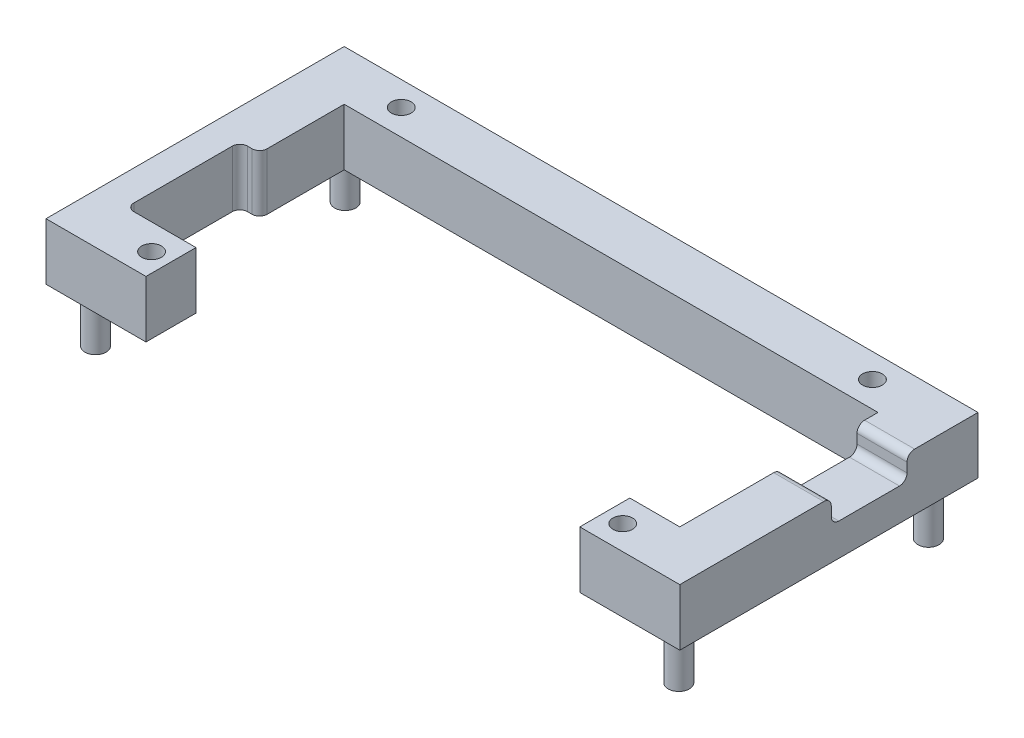
from build123d import *

# Parameters (mm, degrees)
SKETCH1_R           = 1.651
BOSS_EXTRUDE1_DEPTH = 9.525
SKETCH2_W           = 12.7
SKETCH2_H           = 4.099575227
CUT_EXTRUDE7_DEPTH  = 8.89
FILLET2_R           = 1.27
SKETCH3_R           = 1.778
BOSS_EXTRUDE3_DEPTH = 8.89
SKETCH4_W           = 3.302
SKETCH4_H           = 19.05
CUT_EXTRUDE8_DEPTH  = 193.603234356
FILLET3_R           = 1.27


with BuildPart() as part:
    # Sketch1 → Boss-Extrude1 (new body)
    with BuildSketch(Plane(origin=(0, 0, 0), x_dir=(1, 0, 0), z_dir=(0, 1, 0))):
        Polygon((75.155177047, 61.997896552), (75.155177047, 11.997896552), (91.919177047, 11.997896552), (91.919177047, 20.379896552), (83.537177047, 20.379896552), (83.537177047, 53.615896552), (173.037829354, 53.615896552), (173.037829354, 20.379896552), (164.655829354, 20.379896552), (164.655829354, 11.997896552), (181.419829354, 11.997896552), (181.419829354, 61.997896552), align=None)
        with Locations((167.7875512, 57.93100823)):
            Circle(SKETCH1_R, mode=Mode.SUBTRACT)
        with Locations((88.7874552, 57.93100823)):
            Circle(SKETCH1_R, mode=Mode.SUBTRACT)
        with Locations((88.7874552, 16.064784874)):
            Circle(SKETCH1_R, mode=Mode.SUBTRACT)
        with Locations((167.7875512, 16.064784874)):
            Circle(SKETCH1_R, mode=Mode.SUBTRACT)
    extrude(amount=BOSS_EXTRUDE1_DEPTH)

    # Sketch2 → Cut-Extrude7 (cut)
    with BuildSketch(Plane(origin=(181.419829354, 0, 0), x_dir=(0, 0, -1), z_dir=(1, 0, 0))):
        with Locations((43.747896552, 7.475212387)):
            Rectangle(SKETCH2_W, SKETCH2_H)
    extrude(amount=-CUT_EXTRUDE7_DEPTH, mode=Mode.SUBTRACT)

    # Fillet2
    fillet2_edges = [part.edges().sort_by_distance(p)[0] for p in [
        (177.228829354, 5.425424773, -37.397896552),
        (177.228829354, 9.525, -37.397896552),
        (177.228829354, 9.525, -50.097896552),
        (177.228829354, 5.425424773, -50.097896552),
    ]]
    fillet(fillet2_edges, radius=FILLET2_R)

    # Sketch3 → Boss-Extrude3 (add)
    with BuildSketch(Plane.XZ):
        with Locations((79.3894552, -16.064784874)):
            Circle(SKETCH3_R)
        with Locations((177.1855512, -16.064784874)):
            Circle(SKETCH3_R)
        with Locations((79.3894552, -57.93100823)):
            Circle(SKETCH3_R)
        with Locations((177.1855512, -57.93100823)):
            Circle(SKETCH3_R)
    extrude(amount=BOSS_EXTRUDE3_DEPTH)

    # Sketch4 → Cut-Extrude8 (cut, through all)
    with BuildSketch(Plane(origin=(0, 9.525, 0), x_dir=(1, 0, 0), z_dir=(0, 1, 0))):
        with Locations((81.886177047, 29.904896552)):
            Rectangle(SKETCH4_W, SKETCH4_H)
    extrude(amount=-CUT_EXTRUDE8_DEPTH, mode=Mode.SUBTRACT)

    # Fillet3
    fillet3_edges = [part.edges().sort_by_distance(p)[0] for p in [
        (80.235177047, 4.7625, -20.379896552),
        (83.537177047, 4.7625, -39.429896552),
        (80.235177047, 4.7625, -39.429896552),
    ]]
    fillet(fillet3_edges, radius=FILLET3_R)


solid = part.part
